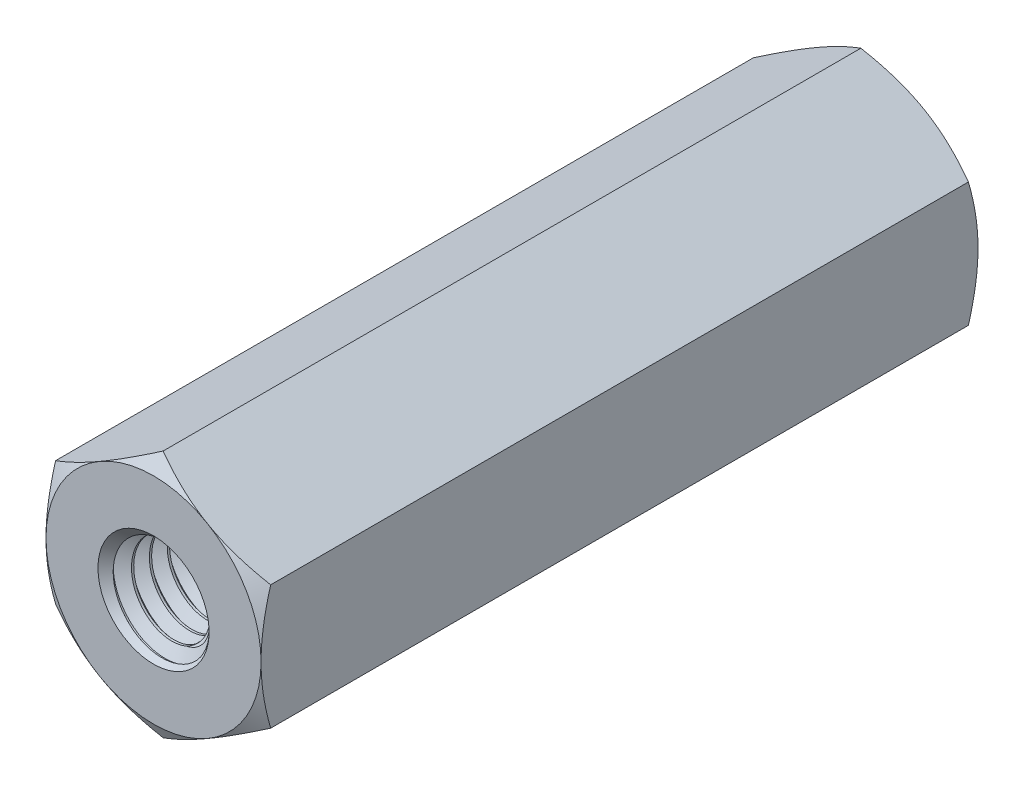
from build123d import *

# Parameters (mm, degrees)
EXTRUDE1_DEPTH          = 10
EXTRUDE1_DEPTH_BACK     = 10
SKETCH1_R               = 1.5
SWEEP1_PITCH            = 0.5
EXTRUDE2_DEPTH          = 22.006120699
SKETCH8_OUTSIDE_W       = 88.722
SKETCH8_OUTSIDE_H       = 89.65
SKETCH8_OUTSIDE_R       = 3
EXTRUDE4_DEPTH          = 22.006120699
EXTRUDE4_DRAFT          = -60
MIRROR1_COPY_1_SKETCH_W = 88.722
MIRROR1_COPY_1_SKETCH_H = 89.65
MIRROR1_COPY_1_SKETCH_R = 3
MIRROR1_COPY_1_DEPTH    = 22.006120699
MIRROR1_COPY_1_DRAFT    = -60


with BuildPart() as part:
    # Sketch1 → Extrude1 (new, two sides: drawn at the far end of the back side and taken through both)
    with BuildSketch(Plane.XY.offset(-EXTRUDE1_DEPTH_BACK)):
        Polygon((0, 3.464101615), (-3, 1.732050808), (-3, -1.732050808), (0, -3.464101615), (3, -1.732050808), (3, 1.732050808), align=None)
        Circle(SKETCH1_R, mode=Mode.SUBTRACT)
    extrude(amount=EXTRUDE1_DEPTH + EXTRUDE1_DEPTH_BACK)

    # Sweep1: arcs per turn and ends read off the stored shape
    # Sweep1: the profile of Sketch12 profile screwed along a right-hand helix through 41 turns, 6 arcs to a turn; built about Z, then put on its axis
    sweep1_z = Axis((0, 0, 0), (0, 0, 1))
    sweep1_corners = [(1.5003, 0, -0.437673205), (1.5003, 0, 0.000173205), (1.175240474, 0, -0.1875), (1.175240474, 0, -0.25)]
    with BuildLine(mode=Mode.PRIVATE) as sweep1_profile:
        Line(sweep1_corners[0], sweep1_corners[1])
        Line(sweep1_corners[1], sweep1_corners[2])
        Line(sweep1_corners[2], sweep1_corners[3])
        Line(sweep1_corners[3], sweep1_corners[0])
    sweep1_cap = Face(sweep1_profile.wire())
    sweep1_turn_angles = [0, 30, 60, 90, 120, 150, 180, 210, 240, 270, 300, 330, 360]
    sweep1_turn_weights = [1, 0.8660254037844387, 1, 0.8660254037844387, 1, 0.8660254037844387, 1, 0.8660254037844387, 1, 0.8660254037844387, 1, 0.8660254037844387, 1]
    sweep1_turn_rails = [Edge.make_bspline([Vector(p[0], p[1], 0).rotate(sweep1_z, sweep1_turn_angles[k]) / sweep1_turn_weights[k] + Vector(0, 0, p[2] + SWEEP1_PITCH * sweep1_turn_angles[k] / 360) for k in range(13)], [0, 0, 0, 1, 1, 2, 2, 3, 3, 4, 4, 5, 5, 6, 6, 6], 2, sweep1_turn_weights) for p in sweep1_corners]
    sweep1_turn_sides = [Face.make_surface_from_curves(sweep1_turn_rails[p[0]], sweep1_turn_rails[p[1]]) for p in [(0, 1), (1, 2), (2, 3), (3, 0)]]
    sweep1 = Plane(origin=(0, 0, -10), x_dir=(0, 1, 0), z_dir=(0, 0, 1)) * Solid(Shell([*[p.moved(Location((0, 0, SWEEP1_PITCH * i))) for i in range(41) for p in sweep1_turn_sides], sweep1_cap, sweep1_cap.rotate(sweep1_z, 14760).moved(Location((0, 0, SWEEP1_PITCH * 14760 / 360)))]))
    add(sweep1)

    # Sketch6 → Extrude2 (cut, through all)
    with BuildSketch(Plane(origin=(0, 0, -10), x_dir=(-1, 0, 0), z_dir=(0, 0, -1))):
        Polygon((0, 3.464101615), (-3, 1.732050808), (-3, -1.732050808), (0, -3.464101615), (3, -1.732050808), (3, 1.732050808), align=None)
    extrude2 = extrude(amount=EXTRUDE2_DEPTH, mode=Mode.SUBTRACT)

    # Extrude3 cone 1 section (through the dimple's axis) → Extrude3 (revolve, cut)
    with BuildSketch(Plane(origin=(0, 0, -10), x_dir=(0, 1, 0), z_dir=(1, 0, 0))):
        Polygon((0, 0), (1.5508, 0), (0, 1.663029396), align=None)
    extrude3 = revolve(axis=Axis((0, 0, -10), (0, 0, 1)), mode=Mode.SUBTRACT)


with BuildPart() as extrude4_tool:
    # Sketch8 outside → Extrude4 (with draft: the straight prism first)
    with BuildSketch(Plane(origin=(0, 0, -10), x_dir=(-1, 0, 0), z_dir=(0, 0, -1))):
        Rectangle(SKETCH8_OUTSIDE_W, SKETCH8_OUTSIDE_H)
        Circle(SKETCH8_OUTSIDE_R, mode=Mode.SUBTRACT)
    extrude(amount=-EXTRUDE4_DEPTH)
    # Extrude4: the draft: its side faces are tilted about the plane it starts from
    extrude4_sides = [extrude4_tool.faces().sort_by_distance(p)[0] for p in [
        (0, -44.825, 1.00306035),
        (-44.361, 0, 1.00306035),
        (0, 44.825, 1.00306035),
        (44.361, 0, 1.00306035),
        (3, 0, 1.00306035),
    ]]
    draft(extrude4_sides, Plane(origin=(0, 0, -10), x_dir=(-1, 0, 0), z_dir=(0, 0, -1)), EXTRUDE4_DRAFT)


with BuildPart() as part_1:
    add(part.part)

    # Extrude4: cut by extrude4_tool
    add(extrude4_tool.part, mode=Mode.SUBTRACT)

    # Mirror1: Extrude2, Extrude3 across plane
    add(extrude2.mirror(Plane.XY), mode=Mode.SUBTRACT)
    add(extrude3.mirror(Plane.XY), mode=Mode.SUBTRACT)


with BuildPart() as mirror1_copy_1_tool:
    # Mirror1 copy 1 sketch → Mirror1 copy 1 (with draft: the straight prism first)
    with BuildSketch(Plane(origin=(0, 0, 10), x_dir=(-1, 0, 0), z_dir=(0, 0, 1))):
        Rectangle(MIRROR1_COPY_1_SKETCH_W, MIRROR1_COPY_1_SKETCH_H)
        Circle(MIRROR1_COPY_1_SKETCH_R, mode=Mode.SUBTRACT)
    extrude(amount=-MIRROR1_COPY_1_DEPTH)
    # Mirror1 copy 1: the draft: its side faces are tilted about the plane it starts from
    mirror1_copy_1_sides = [mirror1_copy_1_tool.faces().sort_by_distance(p)[0] for p in [
        (0, -44.825, -1.00306035),
        (-44.361, 0, -1.00306035),
        (0, 44.825, -1.00306035),
        (44.361, 0, -1.00306035),
        (3, 0, -1.00306035),
    ]]
    draft(mirror1_copy_1_sides, Plane(origin=(0, 0, 10), x_dir=(-1, 0, 0), z_dir=(0, 0, 1)), MIRROR1_COPY_1_DRAFT)


with BuildPart() as part_2:
    add(part_1.part)

    # Mirror1 copy 1: cut by mirror1_copy_1_tool
    add(mirror1_copy_1_tool.part, mode=Mode.SUBTRACT)


solid = part_2.part
